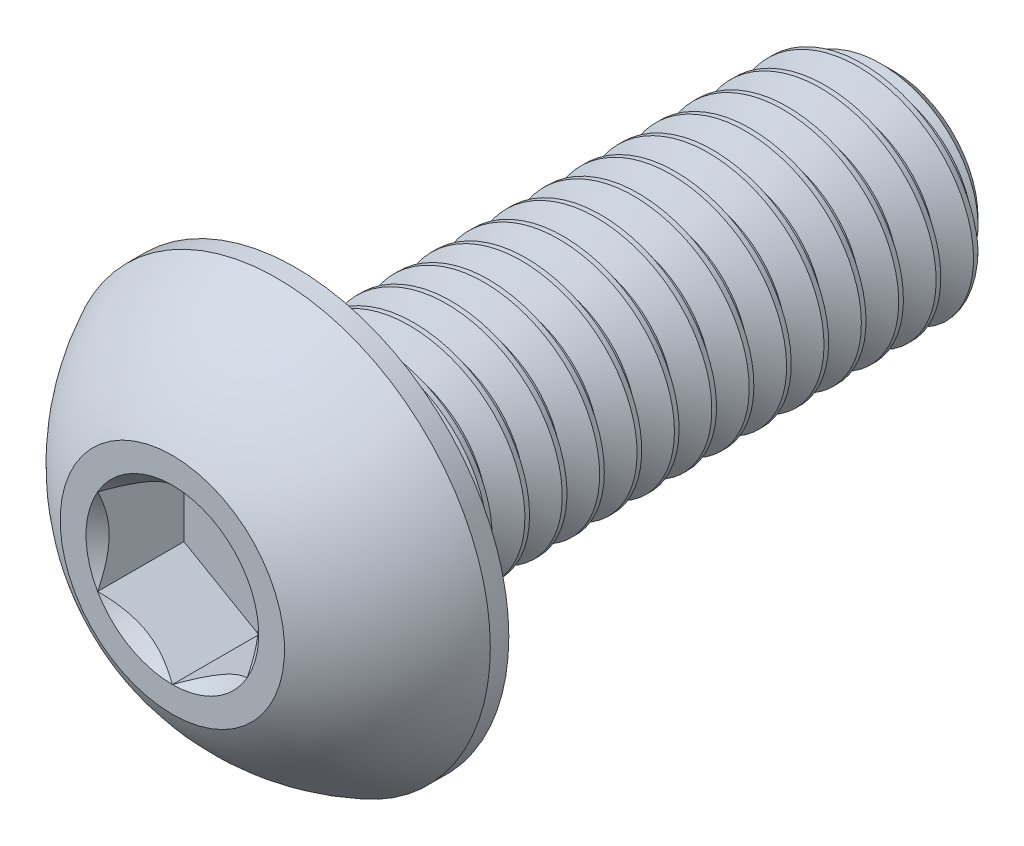
from build123d import *

# Parameters (mm, degrees)
SKETCH1_W              = 8
SKETCH1_H              = 1.5
CUT_EXTRUDE2_DEPTH     = 1.155
SPLIT1_SURFACE_1_BACK  = 13.574
SPLIT1_SURFACE_1_DEPTH = 27.148
SPLIT1_SURFACE_2_BACK  = 13.574
SPLIT1_SURFACE_2_DEPTH = 27.148
CHAMFER1_SIZE          = 0.375
CUT_SWEEP1_PITCH       = 0.5
CUT_SWEEP1_TO          = 8


with BuildPart() as part:
    # Sketch1 → Revolve1 (revolve)
    with BuildSketch(Plane(origin=(0, 0, 0), x_dir=(0, 0, -1), z_dir=(1, 0, 0))):
        with Locations((5.65, 0.75)):
            Rectangle(SKETCH1_W, SKETCH1_H)
    revolve(axis=Axis((0, 0, -9.65), (0, 0, 1)))

    # Sketch7 → Revolve2 (revolve)
    with BuildSketch(Plane(origin=(0, 0, 0), x_dir=(0, 0, -1), z_dir=(1, 0, 0)), mode=Mode.PRIVATE) as revolve2_sk:
        with BuildLine():
            Line((1.4025, 2.85), (1.65, 2.85))
            Line((1.65, 2.85), (1.65, 0))
            Line((1.65, 0), (0, 0))
            Line((0, 0), (0, 1.5))
            ThreePointArc((0, 1.5), (0.59512511, 2.285251969), (1.4025, 2.85))
        make_face()
    revolve(revolve2_sk.sketch.rotate(Axis((0, 0, 0), (0, 0, -1)), 180), axis=Axis((0, 0, 0), (0, 0, -1)))

    # Sketch5 → Cut-Extrude2 (cut)
    with BuildSketch(Plane.XY):
        Polygon((1, -0.577350269), (1, 0.577350269), (0, 1.154700538), (-1, 0.577350269), (-1, -0.577350269), (0, -1.154700538), align=None)
    extrude(amount=-CUT_EXTRUDE2_DEPTH, mode=Mode.SUBTRACT)

    # Cut-Extrude3 cone 1 section (through the dimple's axis) → Cut-Extrude3 (revolve, cut)
    with BuildSketch(Plane(origin=(0, 0, 0), x_dir=(0, -1, 0), z_dir=(1, 0, 0))):
        Polygon((0, 0), (1.154700538, 0), (0, 1.154700538), align=None)
    revolve(axis=Axis((0, 0, 0), (0, 0, -1)), mode=Mode.SUBTRACT)


with BuildPart() as body_2:
    # Split1: the piece behind the surface
    add(part.part)
    # Split1 surface: a surface, the sketch's curves swept straight by 27.148 mm
    with BuildLine(Plane(origin=(0, 0, 0), x_dir=(0, 0, -1), z_dir=(1, 0, 0)).offset(-SPLIT1_SURFACE_1_BACK), mode=Mode.PRIVATE) as split1_surface_1_path:
        Line((1.65, -2.85), (1.65, 2.85))
    split1_surface_1 = Shell.extrude(split1_surface_1_path.wire(), (1 * SPLIT1_SURFACE_1_DEPTH, 0 * SPLIT1_SURFACE_1_DEPTH, 0 * SPLIT1_SURFACE_1_DEPTH))
    split(bisect_by=split1_surface_1, keep=Keep.BOTTOM)

    # Chamfer1
    chamfer1_edges = [body_2.edges().sort_by_distance(p)[0] for p in [
        (0, -1.5, -9.65),
    ]]
    chamfer(chamfer1_edges, length=CHAMFER1_SIZE)

    # Cut-Sweep1: arcs per turn and ends read off the stored shape
    # Cut-Sweep1: the profile of Sketch2 screwed along a right-hand helix through 17 turns, 6 arcs to a turn; built about Z, then put on its axis
    cut_sweep1_z = Axis((0, 0, 0), (0, 0, 1))
    cut_sweep1_corners = [(1.175240474, 0, -0.1875), (1.175240474, 0, -0.25), (1.527063294, 0, -0.453125), (1.527063294, 0, 0.015625)]
    with BuildLine(mode=Mode.PRIVATE) as cut_sweep1_profile:
        Line(cut_sweep1_corners[0], cut_sweep1_corners[1])
        Line(cut_sweep1_corners[1], cut_sweep1_corners[2])
        Line(cut_sweep1_corners[2], cut_sweep1_corners[3])
        Line(cut_sweep1_corners[3], cut_sweep1_corners[0])
    cut_sweep1_cap = Face(cut_sweep1_profile.wire())
    cut_sweep1_turn_angles = [0, 30, 60, 90, 120, 150, 180, 210, 240, 270, 300, 330, 360]
    cut_sweep1_turn_weights = [1, 0.8660254037844387, 1, 0.8660254037844387, 1, 0.8660254037844387, 1, 0.8660254037844387, 1, 0.8660254037844387, 1, 0.8660254037844387, 1]
    cut_sweep1_turn_rails = [Edge.make_bspline([Vector(p[0], p[1], 0).rotate(cut_sweep1_z, cut_sweep1_turn_angles[k]) / cut_sweep1_turn_weights[k] + Vector(0, 0, p[2] + CUT_SWEEP1_PITCH * cut_sweep1_turn_angles[k] / 360) for k in range(13)], [0, 0, 0, 1, 1, 2, 2, 3, 3, 4, 4, 5, 5, 6, 6, 6], 2, cut_sweep1_turn_weights) for p in cut_sweep1_corners]
    cut_sweep1_turn_sides = [Face.make_surface_from_curves(cut_sweep1_turn_rails[p[0]], cut_sweep1_turn_rails[p[1]]) for p in [(0, 1), (1, 2), (2, 3), (3, 0)]]
    cut_sweep1 = Plane(origin=(0, 0, -9.65), x_dir=(0, 1, 0), z_dir=(0, 0, 1)) * split(Solid(Shell([*[p.moved(Location((0, 0, CUT_SWEEP1_PITCH * i))) for i in range(17) for p in cut_sweep1_turn_sides], cut_sweep1_cap, cut_sweep1_cap.rotate(cut_sweep1_z, 6120).moved(Location((0, 0, CUT_SWEEP1_PITCH * 6120 / 360)))])), bisect_by=Plane.XY.offset(CUT_SWEEP1_TO), keep=Keep.BOTTOM, mode=Mode.PRIVATE)
    add(cut_sweep1, mode=Mode.SUBTRACT)


with BuildPart() as part_1:
    add(part.part)

    # Split1: split by a surface, the side it looks to stays
    # Split1 surface: a surface, the sketch's curves swept straight by 27.148 mm
    with BuildLine(Plane(origin=(0, 0, 0), x_dir=(0, 0, -1), z_dir=(1, 0, 0)).offset(-SPLIT1_SURFACE_2_BACK), mode=Mode.PRIVATE) as split1_surface_2_path:
        Line((1.65, -2.85), (1.65, 2.85))
    split1_surface_2 = Shell.extrude(split1_surface_2_path.wire(), (1 * SPLIT1_SURFACE_2_DEPTH, 0 * SPLIT1_SURFACE_2_DEPTH, 0 * SPLIT1_SURFACE_2_DEPTH))
    split(bisect_by=split1_surface_2, keep=Keep.TOP)

    # Combine1: union body 2
    add(body_2.part)


solid = part_1.part
